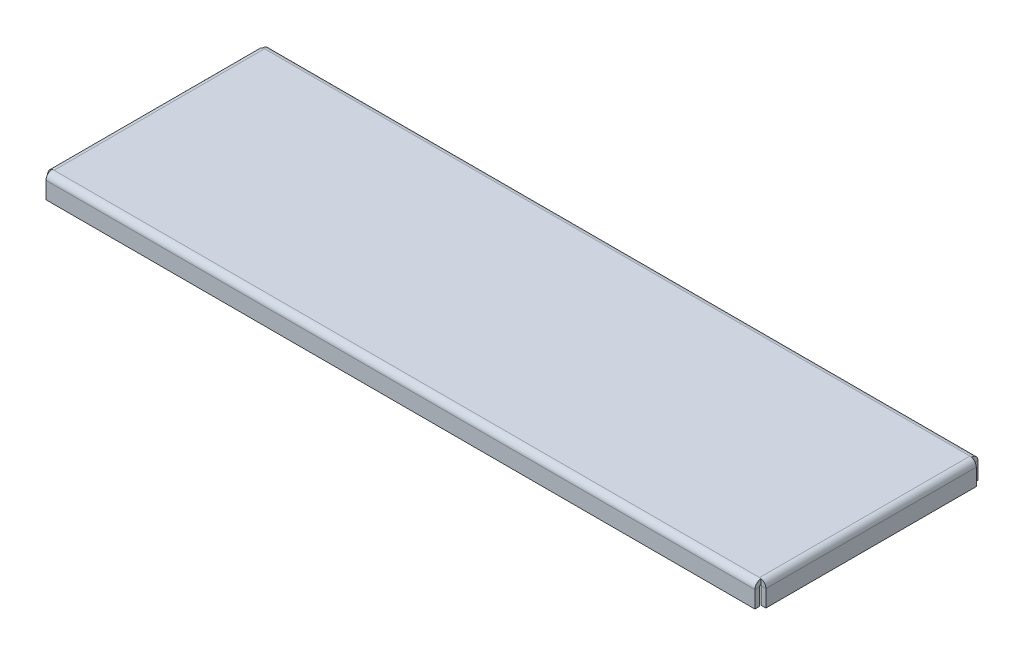
from build123d import *

# Parameters (mm, degrees)
SKETCH1_W                    = 305
SKETCH1_H                    = 10
BASE_FLANGE3_DEPTH           = 2
EDGE_FLANGE1_STRIP_W         = 9.4732
EDGE_FLANGE1_STRIP_H         = 2
EDGE_FLANGE1_STRIP_CUT_DEPTH = 305
EDGE_FLANGE1_DEPTH           = 305
EDGE_FLANGE2_STRIP_W         = 9.4732
EDGE_FLANGE2_STRIP_H         = 2
EDGE_FLANGE2_STRIP_CUT_DEPTH = 305
EDGE_FLANGE2_DEPTH           = 305
EDGE_FLANGE3_STRIP_W         = 9.4732
EDGE_FLANGE3_STRIP_H         = 2
EDGE_FLANGE3_STRIP_CUT_DEPTH = 90.5268
EDGE_FLANGE3_DEPTH           = 90.5268
EDGE_FLANGE4_STRIP_W         = 9.4732
EDGE_FLANGE4_STRIP_H         = 2
EDGE_FLANGE4_STRIP_CUT_DEPTH = 90.5268
EDGE_FLANGE4_DEPTH           = 90.5268


# Sheet-metal steps are written as plain solids
with BuildPart() as part:
    # Sketch1 → Base-Flange3 (new body)
    with BuildSketch(Plane.XY):
        Rectangle(SKETCH1_W, SKETCH1_H)
    extrude(amount=-BASE_FLANGE3_DEPTH)

    # Edge-Flange1 strip (across the edge) → Edge-Flange1 strip cut (cut)
    with BuildSketch(Plane(origin=(-152.5, 5, -2), x_dir=(0, -1, 0), z_dir=(1, 0, 0))):
        with Locations((-2, -1)):
            Rectangle(EDGE_FLANGE1_STRIP_W, EDGE_FLANGE1_STRIP_H)
    extrude(amount=EDGE_FLANGE1_STRIP_CUT_DEPTH, mode=Mode.SUBTRACT)

    # Edge-Flange1 section (across the edge) → Edge-Flange1 (add)
    with BuildSketch(Plane(origin=(-152.5, 5, -2), x_dir=(0, -1, 0), z_dir=(1, 0, 0))):
        with BuildLine():
            Line((0, 0.7366), (0, 94))
            Line((0, 94), (2, 94))
            Line((2, 94), (2, 0.7366))
            ThreePointArc((2, 0.7366), (2.215745145, 0.215745145), (2.7366, 0))
            Line((2.7366, 0), (2.7366, -2))
            ThreePointArc((2.7366, -2), (0.801531583, -1.198468417), (0, 0.7366))
        make_face()
    extrude(amount=EDGE_FLANGE1_DEPTH)

    # Edge-Flange2 strip (across the edge) → Edge-Flange2 strip cut (cut)
    with BuildSketch(Plane(origin=(-152.5, 3, -96), x_dir=(0, 0, 1), z_dir=(1, 0, 0))):
        with Locations((-2, -1)):
            Rectangle(EDGE_FLANGE2_STRIP_W, EDGE_FLANGE2_STRIP_H)
    extrude(amount=EDGE_FLANGE2_STRIP_CUT_DEPTH, mode=Mode.SUBTRACT)

    # Edge-Flange2 section (across the edge) → Edge-Flange2 (add)
    with BuildSketch(Plane(origin=(-152.5, 3, -96), x_dir=(0, 0, 1), z_dir=(1, 0, 0))):
        with BuildLine():
            Line((0, 0.7366), (0, 8))
            Line((0, 8), (2, 8))
            Line((2, 8), (2, 0.7366))
            ThreePointArc((2, 0.7366), (2.215745145, 0.215745145), (2.7366, 0))
            Line((2.7366, 0), (2.7366, -2))
            ThreePointArc((2.7366, -2), (0.801531583, -1.198468417), (0, 0.7366))
        make_face()
    extrude(amount=EDGE_FLANGE2_DEPTH)

    # Edge-Flange3 strip (across the edge) → Edge-Flange3 strip cut (cut)
    with BuildSketch(Plane(origin=(-152.5, 3, -2.7366), x_dir=(1, 0, 0), z_dir=(0, 0, -1))):
        with Locations((-4, -1)):
            Rectangle(EDGE_FLANGE3_STRIP_W, EDGE_FLANGE3_STRIP_H)
    extrude(amount=EDGE_FLANGE3_STRIP_CUT_DEPTH, mode=Mode.SUBTRACT)

    # Edge-Flange3 section (across the edge) → Edge-Flange3 (add)
    with BuildSketch(Plane(origin=(-152.5, 3, -2.7366), x_dir=(1, 0, 0), z_dir=(0, 0, -1))):
        with BuildLine():
            Line((-2, 0.7366), (-2, 8))
            Line((-2, 8), (0, 8))
            Line((0, 8), (0, 0.7366))
            ThreePointArc((0, 0.7366), (0.215745145, 0.215745145), (0.7366, 0))
            Line((0.7366, 0), (0.7366, -2))
            ThreePointArc((0.7366, -2), (-1.198468417, -1.198468417), (-2, 0.7366))
        make_face()
    extrude(amount=EDGE_FLANGE3_DEPTH)

    # Edge-Flange4 strip (across the edge) → Edge-Flange4 strip cut (cut)
    with BuildSketch(Plane(origin=(152.5, 3, -93.2634), x_dir=(-1, 0, 0), z_dir=(0, 0, 1))):
        with Locations((-4, -1)):
            Rectangle(EDGE_FLANGE4_STRIP_W, EDGE_FLANGE4_STRIP_H)
    extrude(amount=EDGE_FLANGE4_STRIP_CUT_DEPTH, mode=Mode.SUBTRACT)

    # Edge-Flange4 section (across the edge) → Edge-Flange4 (add)
    with BuildSketch(Plane(origin=(152.5, 3, -93.2634), x_dir=(-1, 0, 0), z_dir=(0, 0, 1))):
        with BuildLine():
            Line((-2, 0.7366), (-2, 8))
            Line((-2, 8), (0, 8))
            Line((0, 8), (0, 0.7366))
            ThreePointArc((0, 0.7366), (0.215745145, 0.215745145), (0.7366, 0))
            Line((0.7366, 0), (0.7366, -2))
            ThreePointArc((0.7366, -2), (-1.198468417, -1.198468417), (-2, 0.7366))
        make_face()
    extrude(amount=EDGE_FLANGE4_DEPTH)


solid = part.part
